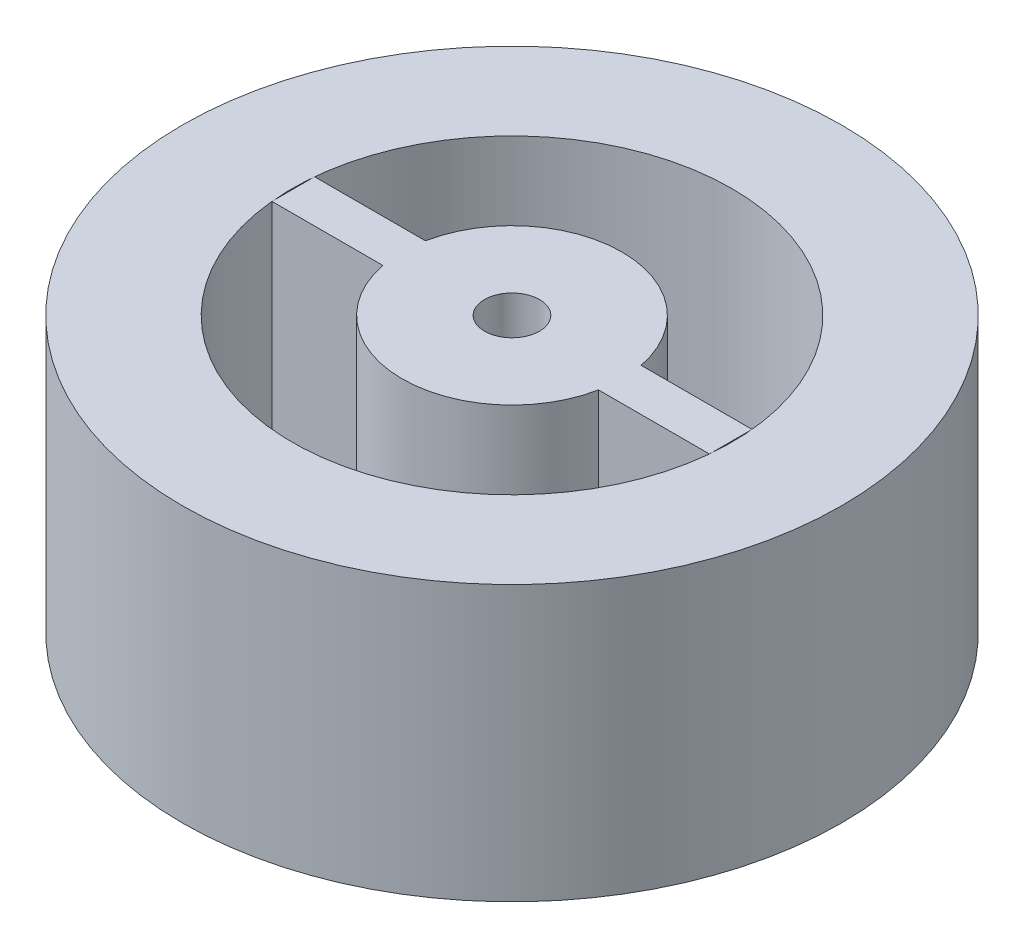
from build123d import *

# Parameters (mm, degrees)
SKETCH2_R               = 6
SKETCH2_R_2             = 0.5
BOSS_EXTRUDE1_DEPTH     = 5
CUT_EXTRUDE1_DEPTH      = 10.848857802
CUT_EXTRUDE1_DEPTH_BACK = 10.848857802
SKETCH4_R               = 4
SKETCH4_R_2             = 2
SKETCH5_W               = 7.962318844
SKETCH5_H               = 0.775550536
BOSS_EXTRUDE2_DEPTH     = 5
CUT_EXTRUDE2_DEPTH      = 10.848857802
CUT_EXTRUDE2_DEPTH_BACK = 10.848857802
SKETCH6_R               = 0.5


with BuildPart() as part:
    # Sketch2 → Boss-Extrude1 (new body)
    with BuildSketch(Plane(origin=(0, 0, 0), x_dir=(1, 0, 0), z_dir=(0, 1, 0))):
        Circle(SKETCH2_R)
        Circle(SKETCH2_R_2, mode=Mode.SUBTRACT)
    extrude(amount=BOSS_EXTRUDE1_DEPTH)

    # Sketch4 → Cut-Extrude1 (cut, two sides: drawn at the far end of the back side and taken through both)
    with BuildSketch(Plane.XZ.offset(-CUT_EXTRUDE1_DEPTH_BACK)):
        Circle(SKETCH4_R)
        Circle(SKETCH4_R_2, mode=Mode.SUBTRACT)
    extrude(amount=CUT_EXTRUDE1_DEPTH + CUT_EXTRUDE1_DEPTH_BACK, mode=Mode.SUBTRACT)


with BuildPart() as cut_extrude1_piece_1:
    # of the separate pieces the step leaves, piece 1, a body of its own (cut_extrude1_pieces)
    add(part.part.solids().sort_by_distance((6, 0, 0))[0])


with BuildPart() as cut_extrude1_piece_2:
    # of the separate pieces the step leaves, piece 2, a body of its own (cut_extrude1_pieces)
    add(part.part.solids().sort_by_distance((2, 0, 0))[0])

    # Sketch5 → Boss-Extrude2 (add)
    with BuildSketch(Plane.XZ):
        Rectangle(SKETCH5_W, SKETCH5_H)
    extrude(amount=-BOSS_EXTRUDE2_DEPTH)

    # Sketch6 → Cut-Extrude2 (cut, two sides: drawn at the far end of the back side and taken through both)
    with BuildSketch(Plane.XZ.offset(-CUT_EXTRUDE2_DEPTH_BACK)):
        Circle(SKETCH6_R)
    extrude(amount=CUT_EXTRUDE2_DEPTH + CUT_EXTRUDE2_DEPTH_BACK, mode=Mode.SUBTRACT)


solid = Compound([cut_extrude1_piece_1.part, cut_extrude1_piece_2.part])
